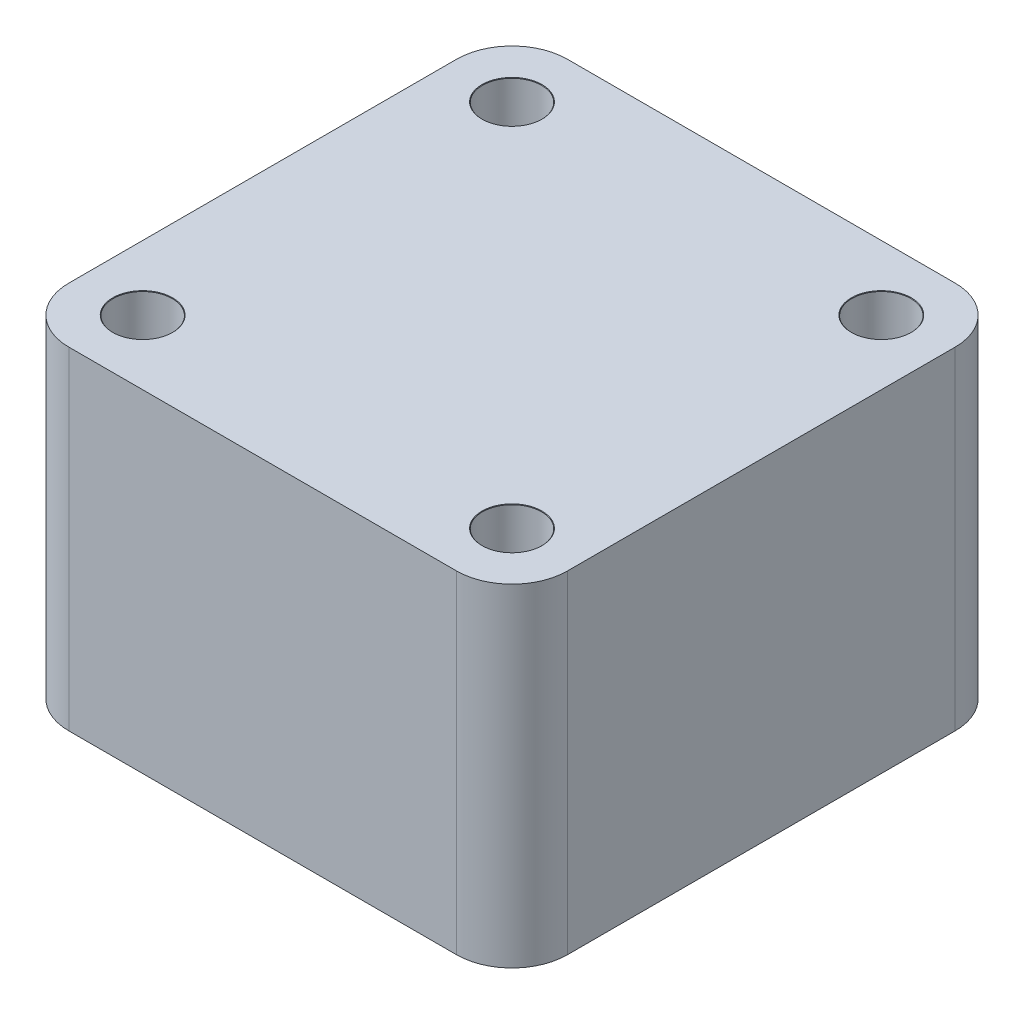
from build123d import *

# Parameters (mm, degrees)
SKETCH1_W                     = 27
SKETCH1_H                     = 27
BOSS_EXTRUDE1_DEPTH           = 18
M3_CLEARANCE_HOLE1_AT_2_COUNT = 2
M3_CLEARANCE_HOLE1_AT_2_PITCH = 20
M3_CLEARANCE_HOLE1_AT_3_COUNT = 2
M3_CLEARANCE_HOLE1_AT_3_PITCH = 28.284271247
M3_CLEARANCE_HOLE1_AT_4_COUNT = 2
M3_CLEARANCE_HOLE1_AT_4_PITCH = 20
FILLET1_R                     = 3


with BuildPart() as part:
    # Sketch1 → Boss-Extrude1 (new body)
    with BuildSketch(Plane(origin=(0, 0, 0), x_dir=(1, 0, 0), z_dir=(0, 1, 0))):
        Rectangle(SKETCH1_W, SKETCH1_H)
    extrude(amount=BOSS_EXTRUDE1_DEPTH)

    # Sketch4 → M3 Clearance Hole1 (revolve, cut)
    with BuildSketch(Plane(origin=(10, 0, -10), x_dir=(0, 0, -1), z_dir=(1, 0, 0))):
        Polygon((0, 0), (0, 18), (1.625, 18), (1.6, 17.975), (1.6, 0.025), (1.625, 0), align=None)
    m3_clearance_hole1 = revolve(axis=Axis((10, -6.35, -10), (0, 1, 0)), mode=Mode.SUBTRACT)

    # M3 Clearance Hole1 at 2: M3 Clearance Hole1 ×2
    with Locations(*[(-i * M3_CLEARANCE_HOLE1_AT_2_PITCH, 0, 0) for i in range(1, M3_CLEARANCE_HOLE1_AT_2_COUNT)]):
        add(m3_clearance_hole1, mode=Mode.SUBTRACT)

    # M3 Clearance Hole1 at 3: M3 Clearance Hole1 ×2
    with Locations(*[Vector(-0.7071067811865476, 0, 0.7071067811865475) * (i * M3_CLEARANCE_HOLE1_AT_3_PITCH) for i in range(1, M3_CLEARANCE_HOLE1_AT_3_COUNT)]):
        add(m3_clearance_hole1, mode=Mode.SUBTRACT)

    # M3 Clearance Hole1 at 4: M3 Clearance Hole1 ×2
    with Locations(*[(0, 0, i * M3_CLEARANCE_HOLE1_AT_4_PITCH) for i in range(1, M3_CLEARANCE_HOLE1_AT_4_COUNT)]):
        add(m3_clearance_hole1, mode=Mode.SUBTRACT)

    # Fillet1
    fillet1_edges = [part.edges().sort_by_distance(p)[0] for p in [
        (13.5, 9, 13.5),
        (-13.5, 9, 13.5),
        (13.5, 9, -13.5),
        (-13.5, 9, -13.5),
    ]]
    fillet(fillet1_edges, radius=FILLET1_R)


solid = part.part
